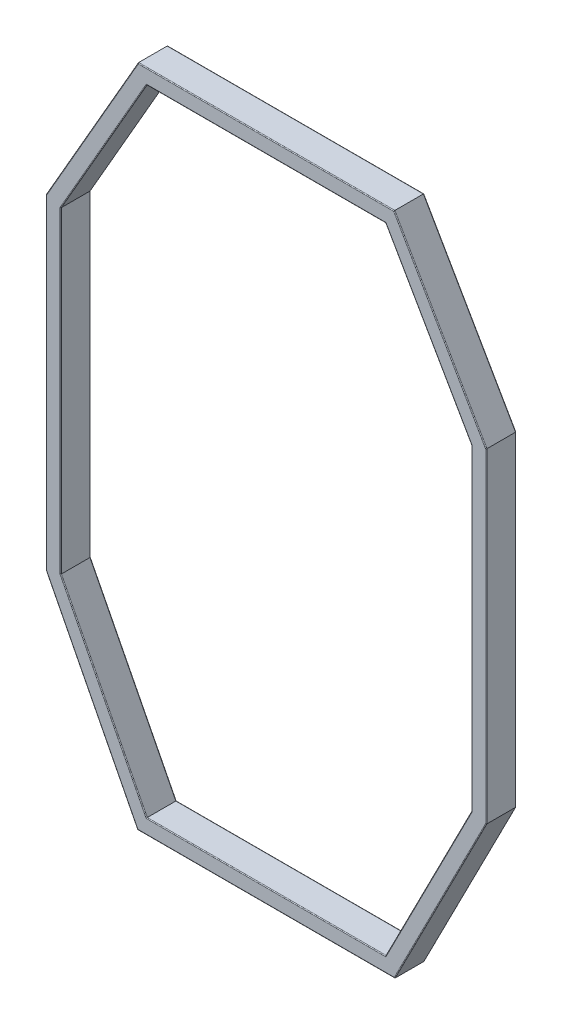
from build123d import *

# Parameters (mm, degrees)
BOSS_EXTRU_1_DEPTH = 80
COQUE1_START       = 4
COQUE1_DEPTH       = 72
CONG_1_R           = 2


# Read off the part's stored shape, not the designer's step: Coque1
with BuildPart() as part:
    # Esquisse1 → Boss.-Extru.1 (new body)
    with BuildSketch(Plane.XY):
        Polygon((-590, 1310.680153009), (-590, 440.370234654), (-344.477435621, -40), (344.477435621, -40), (590, 440.370234654), (590, 1310.680153009), (343.14108798, 1740), (-343.14108798, 1740), align=None)
        Polygon((-320, 1700), (320, 1700), (550, 1300), (550, 450), (320, 0), (-320, 0), (-550, 450), (-550, 1300), align=None, mode=Mode.SUBTRACT)
    extrude(amount=BOSS_EXTRU_1_DEPTH)

    # Coque1 outline → Coque1 (cut)
    with BuildSketch(Plane.XY.offset(COQUE1_START)):
        Polygon((-340.826979182, 1736), (-586, 1309.612137708), (-586, 441.333211189), (-342.029692059, -36), (342.029692059, -36), (586, 441.333211189), (586, 1309.612137708), (340.826979182, 1736), align=None)
        Polygon((-554, 449.037023465), (-554, 1301.068015301), (-322.314108798, 1704), (322.314108798, 1704), (554, 1301.068015301), (554, 449.037023465), (322.447743562, -4), (-322.447743562, -4), align=None, mode=Mode.SUBTRACT)
    extrude(amount=COQUE1_DEPTH, mode=Mode.SUBTRACT)

    # Congé1
    cong_1_edges = [part.edges().sort_by_distance(p)[0] for p in [
        (-467.238717811, 200.185117327, 80),
        (-590, 875.525193832, 0),
        (-466.57054399, 1525.340076505, 0),
        (0, -40, 80),
        (467.238717811, 200.185117327, 80),
        (590, 875.525193832, 80),
        (466.57054399, 1525.340076505, 80),
        (0, 1740, 80),
        (-435, 1500, 0),
        (-550, 875, 0),
        (-435, 225, 0),
        (0, 0, 0),
        (435, 225, 0),
        (550, 875, 0),
        (435, 1500, 0),
        (0, 1700, 0),
        (-435, 1500, 80),
        (-550, 875, 80),
        (-435, 225, 80),
        (0, 0, 80),
        (435, 225, 80),
        (550, 875, 80),
        (435, 1500, 80),
        (0, 1700, 80),
        (-466.57054399, 1525.340076505, 80),
        (-463.413489591, 1522.806068854, 76),
        (-586, 875.472674449, 76),
        (-464.01484603, 202.666605594, 76),
        (0, -36, 76),
        (464.01484603, 202.666605594, 76),
        (586, 875.472674449, 76),
        (463.413489591, 1522.806068854, 76),
        (0, 1736, 76),
        (0, 1704, 4),
        (-438.157054399, 1502.53400765, 4),
        (-554, 875.052519383, 4),
        (-438.223871781, 222.518511733, 4),
        (0, -4, 4),
        (438.223871781, 222.518511733, 4),
        (554, 875.052519383, 4),
        (438.157054399, 1502.53400765, 4),
        (-463.413489591, 1522.806068854, 4),
        (-586, 875.472674449, 4),
        (-464.01484603, 202.666605594, 4),
        (0, -36, 4),
        (464.01484603, 202.666605594, 4),
        (586, 875.472674449, 4),
        (463.413489591, 1522.806068854, 4),
        (0, 1736, 4),
        (-438.157054399, 1502.53400765, 76),
        (-554, 875.052519383, 76),
        (-438.223871781, 222.518511733, 76),
        (0, -4, 76),
        (438.223871781, 222.518511733, 76),
        (554, 875.052519383, 76),
        (438.157054399, 1502.53400765, 76),
        (0, 1704, 76),
        (-590, 875.525193832, 80),
        (0, 1740, 0),
        (466.57054399, 1525.340076505, 0),
        (590, 875.525193832, 0),
        (467.238717811, 200.185117327, 0),
        (0, -40, 0),
        (-467.238717811, 200.185117327, 0),
    ]]
    fillet(cong_1_edges, radius=CONG_1_R)


solid = part.part
